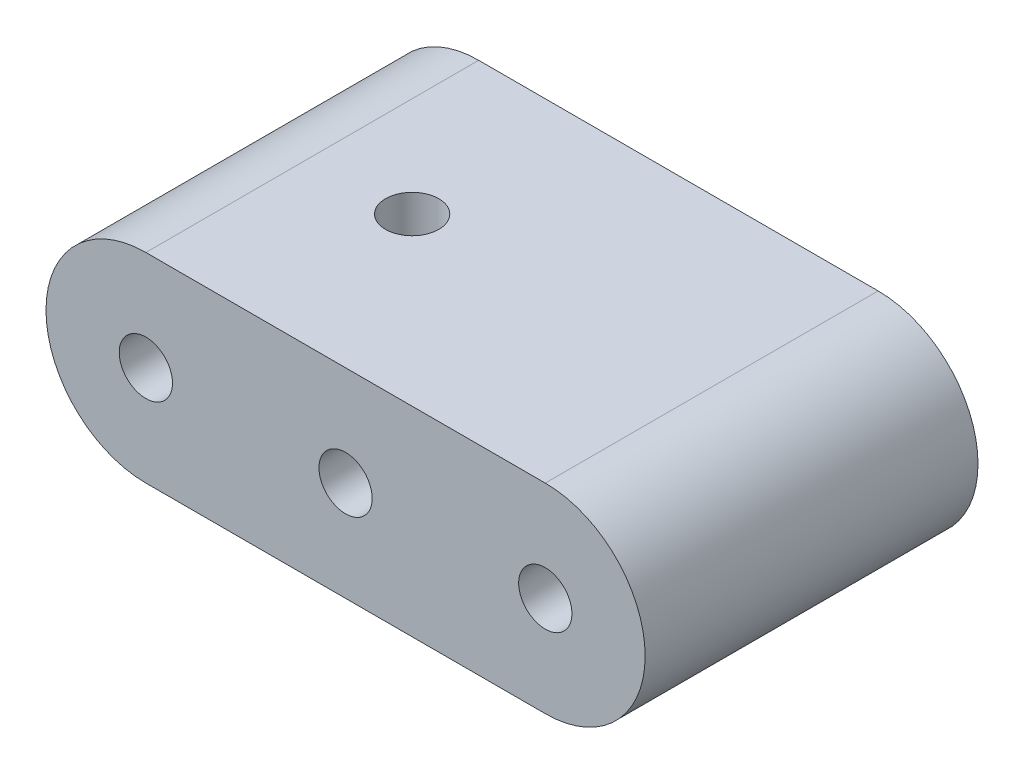
from build123d import *

# Parameters (mm, degrees)
Y_KSEKLIK_EKSTR_ZYON1_DEPTH = 50
IZIM2_R                     = 4
KES_EKSTR_ZYON1_DEPTH       = 6
KES_EKSTR_ZYON2_START       = -6
IZIM3_R                     = 4
KES_EKSTR_ZYON2_DEPTH       = 6
IZIM4_R                     = 4
KES_EKSTR_ZYON3_DEPTH       = 6
KES_EKSTR_ZYON4_DEPTH       = 30


with BuildPart() as part:
    # Çizim1 → Yükseklik-Ekstrüzyon1 (new body)
    with BuildSketch(Plane.XY):
        with BuildLine():
            Line((-30, 15), (30, 15))
            ThreePointArc((30, 15), (45, 0), (30, -15))
            Line((30, -15), (-30, -15))
            ThreePointArc((-30, -15), (-45, 0), (-30, 15))
        make_face()
    extrude(amount=Y_KSEKLIK_EKSTR_ZYON1_DEPTH)

    # Çizim2 → Kes-Ekstrüzyon1 (cut)
    with BuildSketch(Plane.XY.offset(50)):
        with Locations((-30, 0)):
            Circle(IZIM2_R)
        Circle(IZIM2_R)
        with Locations((30, 0)):
            Circle(IZIM2_R)
    extrude(amount=-KES_EKSTR_ZYON1_DEPTH, mode=Mode.SUBTRACT)

    # Çizim3 → Kes-Ekstrüzyon2 (cut)
    with BuildSketch(Plane(origin=(0, 0, 0), x_dir=(-1, 0, 0), z_dir=(0, 0, -1)).offset(KES_EKSTR_ZYON2_START)):
        with Locations((-30, 0)):
            Circle(IZIM3_R)
        Circle(IZIM3_R)
        with Locations((30, 0)):
            Circle(IZIM3_R)
    extrude(amount=KES_EKSTR_ZYON2_DEPTH, mode=Mode.SUBTRACT)

    # Çizim4 → Kes-Ekstrüzyon3 (cut)
    with BuildSketch(Plane(origin=(0, 15, 0), x_dir=(1, 0, 0), z_dir=(0, 1, 0))):
        with Locations((-15, -25)):
            Circle(IZIM4_R)
    extrude(amount=-KES_EKSTR_ZYON3_DEPTH, mode=Mode.SUBTRACT)

    # Çizim5 → Kes-Ekstrüzyon4 (cut)
    with BuildSketch(Plane(origin=(0, 0, 10), x_dir=(-1, 0, 0), z_dir=(0, 0, -1))):
        with BuildLine():
            Line((-21.339745962, 5), (21.339745962, 5))
            ThreePointArc((21.339745962, 5), (40, 0), (21.339745962, -5))
            Line((21.339745962, -5), (-21.339745962, -5))
            ThreePointArc((-21.339745962, -5), (-40, 0), (-21.339745962, 5))
        make_face()
    extrude(amount=-KES_EKSTR_ZYON4_DEPTH, mode=Mode.SUBTRACT)


solid = part.part
